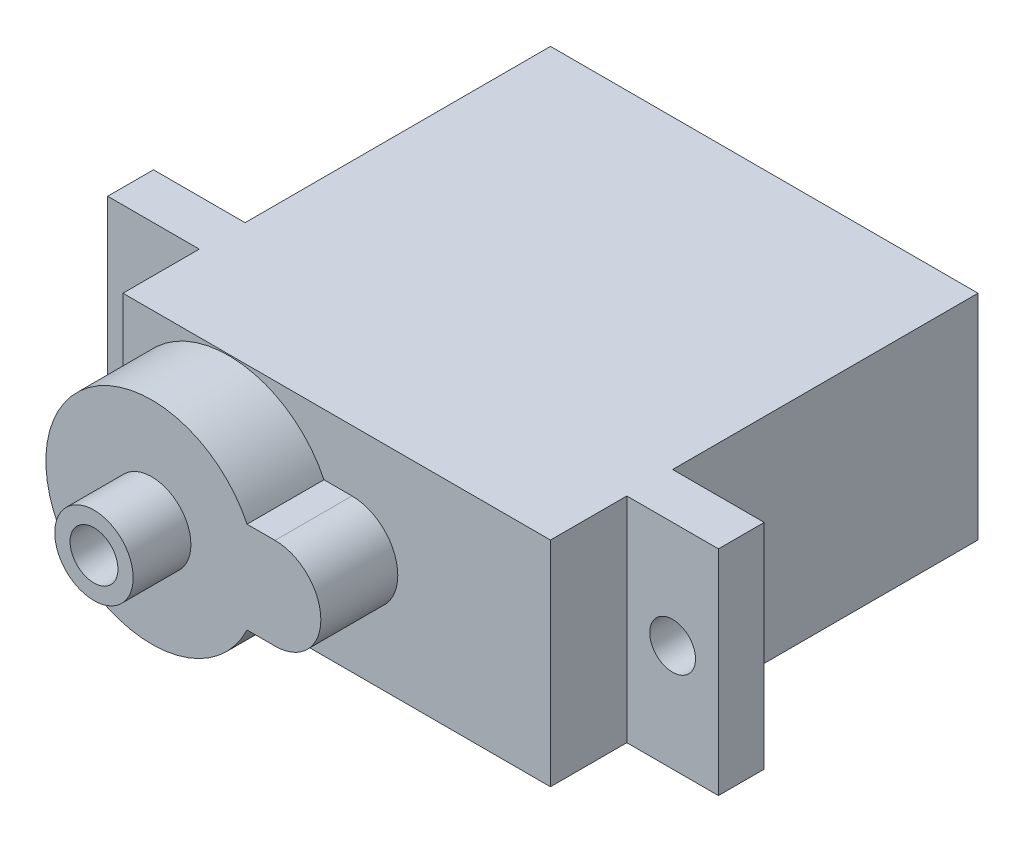
from build123d import *

# Parameters (mm, degrees)
P_IDAT_VYSUNUT_M1_DEPTH  = 5.555
P_IDAT_VYSUNUT_M2_DEPTH  = 4
SKICA3_R                 = 2.03883748
SKICA3_R_2               = 1.24519559
P_IDAT_VYSUNUT_M3_DEPTH  = 3
SKICA5_R                 = 1.190602913
SKICA5_R_2               = 1.19060243
ODEBRAT_VYSUNUT_M1_DEPTH = 23


# Read off the part's stored shape, not the designer's step: Přidat vysunutím2
with BuildPart() as part:
    # Skica1 → Přidat vysunutím1 (new, symmetric)
    with BuildSketch(Plane(origin=(0, 0, 0), x_dir=(1, 0, 0), z_dir=(0, 1, 0))):
        Polygon((11.32935, -15.875), (16.09185, -15.875), (16.09185, -18.25625), (11.32935, -18.25625), (11.32935, -22.225), (-10.89565, -22.225), (-10.89565, -18.25625), (-15.65815, -18.25625), (-15.65815, -15.875), (-10.89565, -15.875), (-10.89565, 0), (11.32935, 0), align=None)
    extrude(amount=P_IDAT_VYSUNUT_M1_DEPTH, both=True)

    # Přidat vysunutím2 outline → Přidat vysunutím2 (add)
    with BuildSketch(Plane.XY.offset(22.225)):
        with BuildLine():
            Line((-10.89565, 0.263816958), (-10.89565, -0.263816958))
            ThreePointArc((-10.89565, -0.263816958), (-6.494080203, -5.390484118), (-0.444197365, -2.381256561))
            Line((-0.444197365, -2.381256561), (1.010536018, -2.381256561))
            ThreePointArc((1.010536018, -2.381256561), (3.391829299, 2.729e-06), (1.010604, 2.38133))
            Line((1.010604, 2.38133), (-0.444232639, 2.38133))
            ThreePointArc((-0.444232639, 2.38133), (-6.494120128, 5.390476029), (-10.89565, 0.263816958))
        make_face()
    extrude(amount=P_IDAT_VYSUNUT_M2_DEPTH)

    # Skica3 → Přidat vysunutím3 (add)
    with BuildSketch(Plane.XY.offset(26.225)):
        with Locations((-5.401980861, 0)):
            Circle(SKICA3_R)
        with Locations((-5.401980861, 0)):
            Circle(SKICA3_R_2, mode=Mode.SUBTRACT)
    extrude(amount=P_IDAT_VYSUNUT_M3_DEPTH)

    # Skica5 → Odebrat vysunutím1 (cut)
    with BuildSketch(Plane.XY.offset(18.25625)):
        with Locations((-13.276937552, 5.8558e-05)):
            Circle(SKICA5_R)
        with Locations((13.71053658, 6.1415e-05)):
            Circle(SKICA5_R_2)
    extrude(amount=-ODEBRAT_VYSUNUT_M1_DEPTH, mode=Mode.SUBTRACT)


solid = part.part
